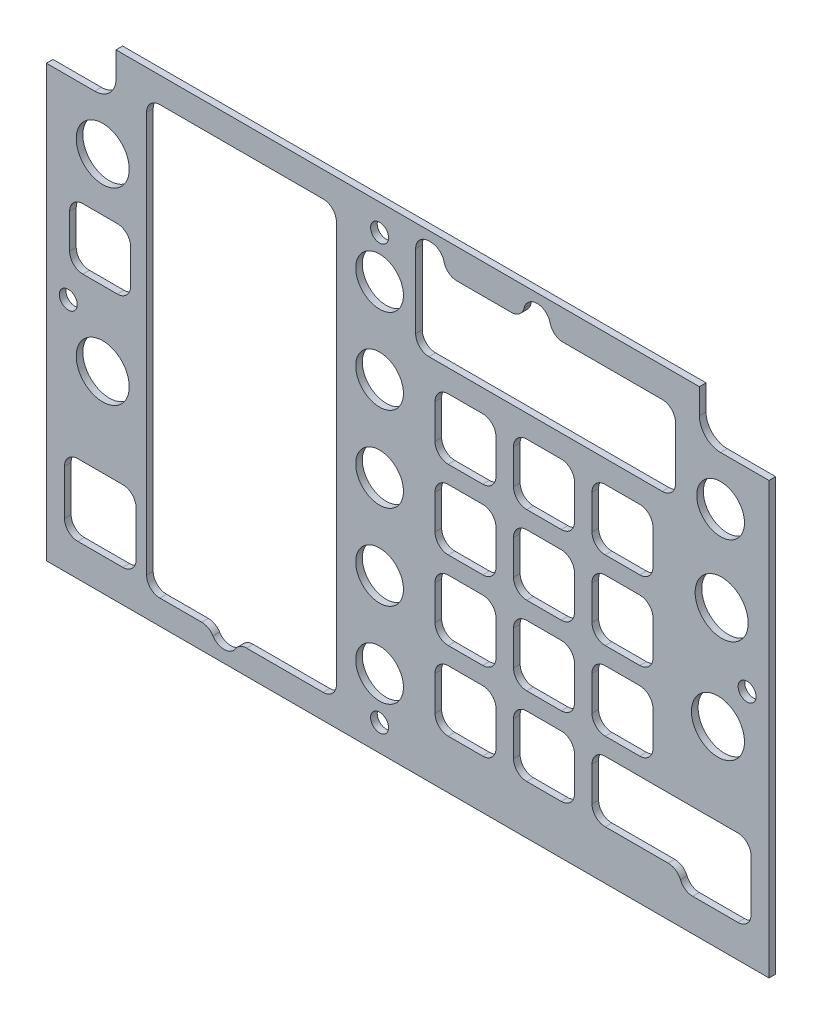
from build123d import *

# Parameters (mm, degrees)
BOSS_EXTRUDE1_DEPTH         = 1.5875
SKETCH2_R                   = 6.35
SKETCH2_R_2                 = 5.715
SKETCH2_W                   = 14.605
SKETCH2_H                   = 14.605
SKETCH2_W_2                 = 17.145
SKETCH2_H_2                 = 17.145
SKETCH2_W_3                 = 62.23
SKETCH2_H_3                 = 19.05
SKETCH2_W_4                 = 45.462
SKETCH2_H_4                 = 102.32
CUT_EXTRUDE1_DEPTH          = 202.151445736
F_6_CLEARANCE_HOLE2_D       = 4.3053
F_1_4_0_25_DIAMETER_HOLE1_D = 6.35
CUT_EXTRUDE3_DEPTH          = 202.151445736
FILLET1_R                   = 3.175
FILLET2_R                   = 3.175


with BuildPart() as part:
    # Sketch1 → Boss-Extrude1 (new body)
    with BuildSketch(Plane.XY):
        with BuildLine():
            Line((58.206752076, 169.534029068), (58.206752076, 175.566529068))
            Line((58.206752076, 175.566529068), (-81.493247924, 175.566529068))
            Line((-81.493247924, 175.566529068), (-81.493247924, 169.534029068))
            ThreePointArc((-81.493247924, 169.534029068), (-82.981145475, 165.941926619), (-86.573247924, 164.454029068))
            Line((-86.573247924, 164.454029068), (-98.161997924, 164.454029068))
            Line((-98.161997924, 164.454029068), (-98.161997924, 61.266529068))
            Line((-98.161997924, 61.266529068), (74.875502076, 61.266529068))
            Line((74.875502076, 61.266529068), (74.875502076, 164.454029068))
            Line((74.875502076, 164.454029068), (63.286752076, 164.454029068))
            ThreePointArc((63.286752076, 164.454029068), (59.694649628, 165.941926619), (58.206752076, 169.534029068))
        make_face()
    extrude(amount=BOSS_EXTRUDE1_DEPTH)

    # Sketch2 → Cut-Extrude1 (cut, through all)
    with BuildSketch(Plane.XY.offset(1.5875)):
        with Locations((-84.668247924, 152.389029068)):
            Circle(SKETCH2_R)
        with Locations((-84.668247924, 107.304029068)):
            Circle(SKETCH2_R)
        with Locations((63.540752076, 132.386529068)):
            Circle(SKETCH2_R)
        with Locations((62.651752076, 107.304029068)):
            Circle(SKETCH2_R)
        with Locations((-18.374247924, 77.776529068)):
            Circle(SKETCH2_R_2)
        with Locations((-18.374247924, 98.096529068)):
            Circle(SKETCH2_R_2)
        with Locations((-18.374247924, 118.416529068)):
            Circle(SKETCH2_R_2)
        with Locations((-18.374247924, 138.736529068)):
            Circle(SKETCH2_R_2)
        with Locations((-18.374247924, 159.056529068)):
            Circle(SKETCH2_R_2)
        with Locations((63.286752076, 152.706529068)):
            Circle(SKETCH2_R_2)
        with Locations((39.791752076, 136.704529068)):
            Rectangle(SKETCH2_W, SKETCH2_H)
        with Locations((62.004966978, 77.649529068)):
            Rectangle(SKETCH2_W_2, SKETCH2_H_2)
        with Locations((20.995752076, 136.704529068)):
            Rectangle(SKETCH2_W, SKETCH2_H)
        with Locations((2.199752076, 136.704529068)):
            Rectangle(SKETCH2_W, SKETCH2_H)
        with Locations((21.376752076, 158.929529068)):
            Rectangle(SKETCH2_W_3, SKETCH2_H_3)
        with Locations((39.791752076, 80.316529068)):
            Rectangle(SKETCH2_W, SKETCH2_H)
        with Locations((39.791752076, 99.112529068)):
            Rectangle(SKETCH2_W, SKETCH2_H)
        with Locations((39.791752076, 117.908529068)):
            Rectangle(SKETCH2_W, SKETCH2_H)
        with Locations((20.995752076, 80.316529068)):
            Rectangle(SKETCH2_W, SKETCH2_H)
        with Locations((-85.255785181, 77.63300664)):
            Rectangle(SKETCH2_W_2, SKETCH2_H_2)
        with Locations((20.995752076, 99.112529068)):
            Rectangle(SKETCH2_W, SKETCH2_H)
        with Locations((20.995752076, 117.908529068)):
            Rectangle(SKETCH2_W, SKETCH2_H)
        with Locations((2.199752076, 117.908529068)):
            Rectangle(SKETCH2_W, SKETCH2_H)
        with Locations((2.199752076, 99.112529068)):
            Rectangle(SKETCH2_W, SKETCH2_H)
        with Locations((2.199752076, 80.316529068)):
            Rectangle(SKETCH2_W, SKETCH2_H)
        with Locations((-85.303247924, 132.386529068)):
            Rectangle(SKETCH2_W, SKETCH2_H)
        with Locations((-51.442247924, 118.289529068)):
            Rectangle(SKETCH2_W_4, SKETCH2_H_4)
    extrude(amount=-CUT_EXTRUDE1_DEPTH, mode=Mode.SUBTRACT)

    # #6 Clearance Hole2 (through all)
    with Locations(Plane(origin=(-11.643247924, -6.662700632, -3.175), x_dir=(-1, 0, 0), z_dir=(0, 0, -1))):
        with Locations((-81.28, 124.6982297), (6.731, 175.8792297), (81.28, 124.6982297), (6.731, 74.2792297)):
            Hole(F_6_CLEARANCE_HOLE2_D / 2)

    # 1/4 (0.25) Diameter Hole1 (through all)
    with Locations(Plane(origin=(0, 0, 0), x_dir=(-1, 0, 0), z_dir=(0, 0, -1))):
        with Locations((55.583247924, 67.341529068), (-49.826752076, 81.946529068), (-19.346752076, 170.211529068), (6.053247924, 170.211529068)):
            Hole(F_1_4_0_25_DIAMETER_HOLE1_D / 2)

    # Sketch10 → Cut-Extrude3 (cut, through all)
    with BuildSketch(Plane(origin=(0, 0, 0), x_dir=(-1, 0, 0), z_dir=(0, 0, -1))):
        with BuildLine():
            Line((9.738247924, 168.454529068), (9.738247924, 173.386529068))
            Line((9.738247924, 173.386529068), (6.053247924, 173.386529068))
            ThreePointArc((6.053247924, 173.386529068), (8.85138123, 171.711887358), (8.697784934, 168.454529068))
            Line((8.697784934, 168.454529068), (9.738247924, 168.454529068))
        make_face()
        Polygon((-47.094252076, 87.619029068), (-47.094252076, 73.014029068), (-53.432466978, 73.014029068), (-53.432466978, 86.222029068), (-70.577466978, 86.222029068), (-70.577466978, 87.619029068), align=None)
    extrude(amount=-CUT_EXTRUDE3_DEPTH, mode=Mode.SUBTRACT)

    # Fillet1
    fillet1_edges = [part.edges().sort_by_distance(p)[0] for p in [
        (-78.000747924, 139.689029068, 0.79375),
        (-78.000747924, 125.084029068, 0.79375),
        (-92.605747924, 125.084029068, 0.79375),
        (-92.605747924, 139.689029068, 0.79375),
        (-74.173247924, 169.449529068, 0.79375),
        (-28.711247924, 169.449529068, 0.79375),
        (-28.711247924, 67.129529068, 0.79375),
        (-52.415333626, 67.129529068, 0.79375),
        (-58.751162222, 67.129529068, 0.79375),
        (-74.173247924, 67.129529068, 0.79375),
        (-93.828285181, 69.06050664, 0.79375),
        (-93.828285181, 86.20550664, 0.79375),
        (-76.683285181, 86.20550664, 0.79375),
        (-76.683285181, 69.06050664, 0.79375),
        (32.489252076, 73.014029068, 0.79375),
        (70.577466978, 87.619029068, 0.79375),
        (70.577466978, 69.077029068, 0.79375),
        (53.432466978, 69.077029068, 0.79375),
        (32.489252076, 87.619029068, 0.79375),
        (13.693252076, 73.014029068, 0.79375),
        (28.298252076, 87.619029068, 0.79375),
        (28.298252076, 73.014029068, 0.79375),
        (13.693252076, 87.619029068, 0.79375),
        (-5.102747924, 73.014029068, 0.79375),
        (9.502252076, 87.619029068, 0.79375),
        (9.502252076, 73.014029068, 0.79375),
        (-5.102747924, 87.619029068, 0.79375),
        (-5.102747924, 91.810029068, 0.79375),
        (-5.102747924, 106.415029068, 0.79375),
        (9.502252076, 91.810029068, 0.79375),
        (9.502252076, 106.415029068, 0.79375),
        (13.693252076, 91.810029068, 0.79375),
        (13.693252076, 106.415029068, 0.79375),
        (28.298252076, 91.810029068, 0.79375),
        (28.298252076, 106.415029068, 0.79375),
        (32.489252076, 91.810029068, 0.79375),
        (47.094252076, 106.415029068, 0.79375),
        (47.094252076, 91.810029068, 0.79375),
        (32.489252076, 106.415029068, 0.79375),
        (32.489252076, 110.606029068, 0.79375),
        (47.094252076, 125.211029068, 0.79375),
        (47.094252076, 110.606029068, 0.79375),
        (32.489252076, 125.211029068, 0.79375),
        (13.693252076, 110.606029068, 0.79375),
        (28.298252076, 125.211029068, 0.79375),
        (28.298252076, 110.606029068, 0.79375),
        (13.693252076, 125.211029068, 0.79375),
        (9.502252076, 110.606029068, 0.79375),
        (-5.102747924, 110.606029068, 0.79375),
        (-5.102747924, 125.211029068, 0.79375),
        (9.502252076, 125.211029068, 0.79375),
        (9.502252076, 129.402029068, 0.79375),
        (-5.102747924, 129.402029068, 0.79375),
        (-5.102747924, 144.007029068, 0.79375),
        (9.502252076, 144.007029068, 0.79375),
        (13.693252076, 129.402029068, 0.79375),
        (13.693252076, 144.007029068, 0.79375),
        (28.298252076, 129.402029068, 0.79375),
        (28.298252076, 144.007029068, 0.79375),
        (32.489252076, 129.402029068, 0.79375),
        (47.094252076, 144.007029068, 0.79375),
        (47.094252076, 129.402029068, 0.79375),
        (32.489252076, 144.007029068, 0.79375),
        (52.491752076, 168.454529068, 0.79375),
        (52.491752076, 149.404529068, 0.79375),
        (-9.738247924, 149.404529068, 0.79375),
        (-9.738247924, 173.386529068, 0.79375),
        (-3.408710914, 168.454529068, 0.79375),
        (16.702215066, 168.454529068, 0.79375),
        (21.991289086, 168.454529068, 0.79375),
    ]]
    fillet(fillet1_edges, radius=FILLET1_R)

    # Fillet2
    fillet2_edges = [part.edges().sort_by_distance(p)[0] for p in [
        (53.432466978, 73.014029068, 0.79375),
    ]]
    fillet(fillet2_edges, radius=FILLET2_R)


solid = part.part
